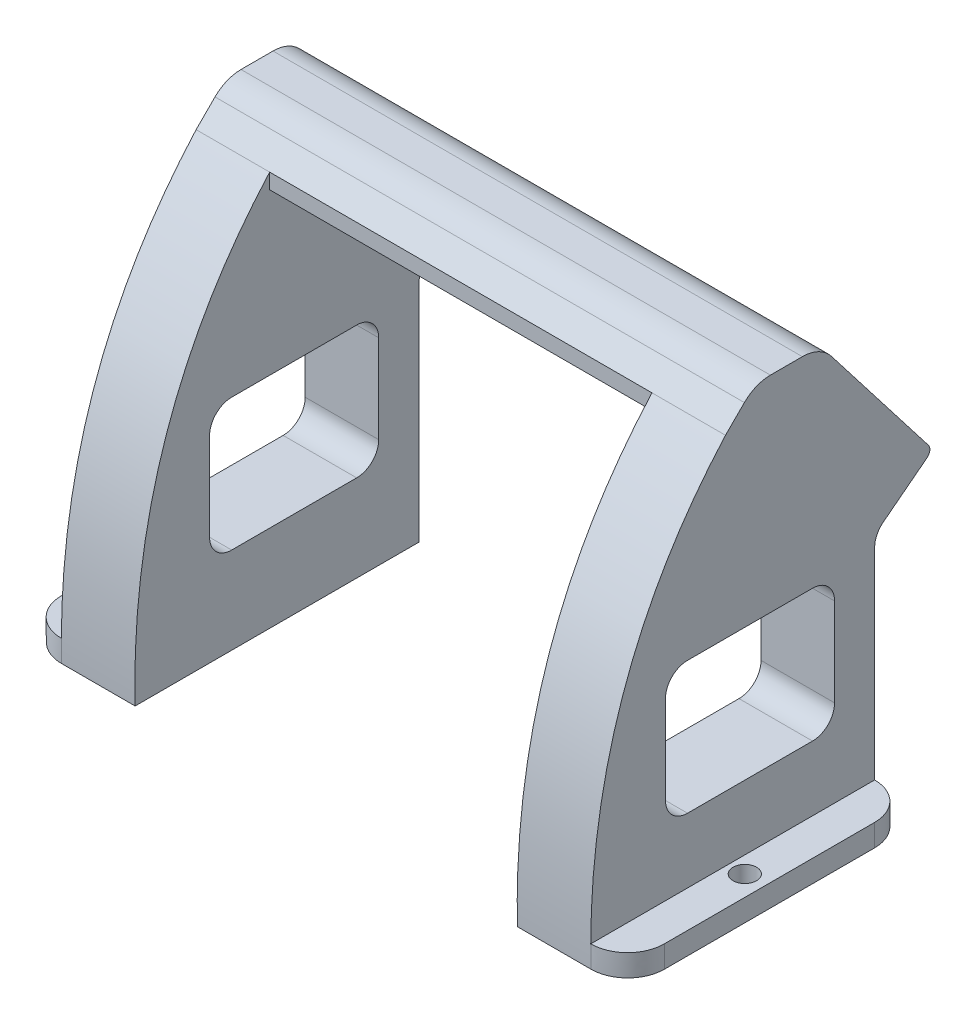
from build123d import *

# Parameters (mm, degrees)
EXTRUDE_1_DEPTH     = 5
SKETCH_2_W          = 5
SKETCH_2_H          = 25
EXTRUDE_2_DEPTH     = 10
EXTRUDE_3_DEPTH     = 43
EXTRUDE_4_DEPTH     = 10
CUT_EXTRUDE_1_DEPTH = 58
EXTRUDE_5_DEPTH     = 7
EXTRUDE_6_DEPTH     = 7
EXTRUDE_7_DEPTH     = 10
EXTRUDE_8_DEPTH     = 72
SKETCH_10_W         = 10
SKETCH_10_H         = 20.288176
EXTRUDE_9_DEPTH     = 5.9
FILLET_START        = -61
FILLET_1_DEPTH      = 74
FILLET_START_2      = -53.20464
FILLET_1_2_DEPTH    = 57.6
FILLET_START_3      = -60
FILLET_1_3_DEPTH    = 10
FILLET_START_4      = 2
FILLET_1_4_DEPTH    = 10
SKETCH_11_W         = 20.288176
SKETCH_11_H         = 3
EXTRUDE_10_DEPTH    = 5
SKETCH_12_R         = 1.6
CUT_EXTRUDE_2_DEPTH = 3
FILLET_3_R          = 1
SKETCH_13_W         = 15
SKETCH_13_H         = 3
EXTRUDE_11_DEPTH    = 2
CUT_EXTRUDE_3_REACH = 83.122
SKETCH_14_W         = 20
SKETCH_14_H         = 10
EXTRUDE_12_DEPTH    = 10
EXTRUDE_START       = 2
EXTRUDE_13_DEPTH    = 15
SKETCH_20_W         = 18
SKETCH_20_H         = 18
CUT_EXTRUDE_5_DEPTH = 98.660914
FILLET_7_R          = 5
CUT_EXTRUDE_6_DEPTH = 98.660914
FILLET_8_R          = 5
FILLET_9_R          = 5
SKETCH_22_W         = 5
SKETCH_22_H         = 18
CUT_EXTRUDE_7_DEPTH = 98.660914
FILLET_10_R         = 3
CUT_EXTRUDE_8_REACH = 98.904
SKETCH_23_R         = 1.6


with BuildPart() as part:
    # 草图1 → 凸台-拉伸1 (new body)
    with BuildSketch(Plane(origin=(0, 0, 0), x_dir=(0, 0, -1), z_dir=(1, 0, 0))):
        Polygon((0, 0), (11.868353, 9.172906), (-3.419823, 28.953494), (-15.288176, 19.780588), align=None)
    extrude(amount=EXTRUDE_1_DEPTH)

    # 草图2 → 凸台-拉伸2 (add)
    with BuildSketch(Plane(origin=(0, 0, 0), x_dir=(1, 0, 0), z_dir=(0, -0.6115270401858328, 0.7912235329674888))):
        with Locations((2.5, 12.5)):
            Rectangle(SKETCH_2_W, SKETCH_2_H)
    extrude(amount=EXTRUDE_2_DEPTH)

    # 草图3 → 凸台-拉伸3 (add)
    with BuildSketch(Plane.ZY):
        Polygon((23.200411, 13.665318), (15.288176, 19.780588), (0, 0), (7.912235, -6.11527), align=None)
    extrude(amount=EXTRUDE_3_DEPTH)

    # 草图4 → 凸台-拉伸4 (add)
    with BuildSketch(Plane.ZY.offset(43)):
        Polygon((15.288176, 19.780588), (3.419823, 28.953494), (-11.868353, 9.172906), (0, 0), (7.912235, -6.11527), (23.200411, 13.665318), align=None)
    extrude(amount=EXTRUDE_4_DEPTH)

    # 草图5 → 切除-拉伸1 (cut)
    with BuildSketch(Plane.ZY.offset(53)):
        Polygon((15.288176, 19.780588), (3.419823, 28.953494), (-11.868353, 9.172906), (0, 0), align=None)
    extrude(amount=-CUT_EXTRUDE_1_DEPTH, mode=Mode.SUBTRACT)

    # 草图6 → 凸台-拉伸5 (add)
    with BuildSketch(Plane.ZY.offset(53)):
        Polygon((15.288176, 19.780588), (0, 0), (7.912235, -6.11527), (23.200411, 13.665318), align=None)
    extrude(amount=EXTRUDE_5_DEPTH)

    # 草图7 → 凸台-拉伸6 (add)
    with BuildSketch(Plane(origin=(5, 0, 0), x_dir=(0, 0, -1), z_dir=(1, 0, 0))):
        Polygon((0, 0), (-15.288176, 19.780588), (-23.200411, 13.665318), (-7.912235, -6.11527), align=None)
    extrude(amount=EXTRUDE_6_DEPTH)

    # 草图8 → 凸台-拉伸7 (add)
    with BuildSketch(Plane(origin=(12, 0, 0), x_dir=(0, 0, -1), z_dir=(1, 0, 0))):
        Polygon((-23.200411, 13.665318), (-28.200411, 13.665318), (-28.200411, -24.848688), (-28.200411, -32.095582), (-7.912235, -32.095582), (-7.912235, -24.848688), (-7.912235, -6.11527), align=None)
    extrude_7 = extrude(amount=-EXTRUDE_7_DEPTH)

    # 镜向1: 凸台-拉伸7 across plane
    add(extrude_7.mirror(Plane.ZY.offset(24)))

    # 草图9 → 凸台-拉伸8 (add)
    with BuildSketch(Plane.ZY.offset(60)):
        Polygon((23.200411, 13.665318), (28.200411, 13.665318), (28.200411, 19.780588), (15.288176, 19.780588), align=None)
    extrude(amount=-EXTRUDE_8_DEPTH)

    # 草图10 → 凸台-拉伸9 (add)
    with BuildSketch(Plane.XZ.offset(32.095582)):
        with Locations((7, 18.056323)):
            Rectangle(SKETCH_10_W, SKETCH_10_H)
        with Locations((-55, 18.056323)):
            Rectangle(SKETCH_10_W, SKETCH_10_H)
    extrude(amount=EXTRUDE_9_DEPTH)

    # 圆角1: read off the stored shape, not the designer's step
    # 圆角1 outline → 圆角1 (cut)
    with BuildSketch(Plane.YZ.offset(FILLET_START)):
        with BuildLine():
            Line((19.780588, 28.200411), (16.780588, 28.200411))
            ThreePointArc((16.780588, 28.200411), (18.901909, 27.321732), (19.780588, 25.200411))
            Line((19.780588, 25.200411), (19.780588, 28.200411))
        make_face()
    extrude(amount=FILLET_1_DEPTH, mode=Mode.SUBTRACT)

    # Fillet 1 2 outline → Fillet 1 2 (add)
    with BuildSketch(Plane.YZ.offset(FILLET_START_2)):
        with BuildLine():
            ThreePointArc((13.665318, 24.673344), (13.358248, 23.351176), (12.499899, 22.299673))
            Line((12.499899, 22.299673), (13.665318, 23.200411))
            Line((13.665318, 23.200411), (13.665318, 24.673344))
        make_face()
    extrude(amount=FILLET_1_2_DEPTH)

    # Fillet 1 3 outline → Fillet 1 3 (add)
    with BuildSketch(Plane.YZ.offset(FILLET_START_3)):
        with BuildLine():
            ThreePointArc((-7.588203, 7.912235), (-6.266035, 7.605165), (-5.214532, 6.746816))
            Line((-5.214532, 6.746816), (-6.11527, 7.912235))
            Line((-6.11527, 7.912235), (-7.588203, 7.912235))
        make_face()
    extrude(amount=FILLET_1_3_DEPTH)

    # Fillet 1 4 outline → Fillet 1 4 (add)
    with BuildSketch(Plane.YZ.offset(FILLET_START_4)):
        with BuildLine():
            ThreePointArc((-7.588203, 7.912235), (-6.266035, 7.605165), (-5.214532, 6.746816))
            Line((-5.214532, 6.746816), (-6.11527, 7.912235))
            Line((-6.11527, 7.912235), (-7.588203, 7.912235))
        make_face()
    extrude(amount=FILLET_1_4_DEPTH)

    # 草图11 → 凸台-拉伸10 (add)
    with BuildSketch(Plane(origin=(12, 0, 0), x_dir=(0, 0, -1), z_dir=(1, 0, 0))):
        with Locations((-18.056323, -36.495582)):
            Rectangle(SKETCH_11_W, SKETCH_11_H)
    extrude_10 = extrude(amount=EXTRUDE_10_DEPTH)

    # 草图12 → 切除-拉伸2 (cut)
    with BuildSketch(Plane(origin=(0, -34.995582, 0), x_dir=(1, 0, 0), z_dir=(0, 1, 0))):
        with Locations((14.243648, -27.816949)):
            Circle(SKETCH_12_R)
    cut_extrude_2 = extrude(amount=-CUT_EXTRUDE_2_DEPTH, mode=Mode.SUBTRACT)

    # 镜向2: 凸台-拉伸10, 切除-拉伸2 across plane
    add(extrude_10.mirror(Plane.ZY.offset(24)))
    add(cut_extrude_2.mirror(Plane.ZY.offset(24)), mode=Mode.SUBTRACT)

    # 圆角3
    fillet_3_edges = [part.edges().sort_by_distance(p)[0] for p in [
        (-24, 0, 0),
    ]]
    fillet(fillet_3_edges, radius=FILLET_3_R)

    # 草图13 → 凸台-拉伸11 (add)
    with BuildSketch(Plane.XY.offset(28.200411)):
        with Locations((-57.5, -36.495582)):
            Rectangle(SKETCH_13_W, SKETCH_13_H)
        with Locations((9.5, -36.495582)):
            Rectangle(SKETCH_13_W, SKETCH_13_H)
    extrude(amount=EXTRUDE_11_DEPTH)

    # 草图14 → 切除-拉伸3 (cut, up to next)
    with BuildSketch(Plane(origin=(0, 0, 0), x_dir=(-1, 0, 0), z_dir=(0, 0.6115270401858329, -0.7912235329674886)), mode=Mode.PRIVATE) as cut_extrude_3_sk1:
        with Locations((24, 13)):
            Rectangle(SKETCH_14_W, SKETCH_14_H)
    cut_extrude_3_tool1 = extrude(cut_extrude_3_sk1.sketch, amount=-CUT_EXTRUDE_3_REACH, mode=Mode.PRIVATE) & part.part
    add(cut_extrude_3_tool1.solids().sort_by_distance((-24, 10.285906, 7.949852))[0], mode=Mode.SUBTRACT)

    # 草图18 → 凸台-拉伸12 (add)
    with BuildSketch(Plane(origin=(12, 0, 0), x_dir=(0, 0, -1), z_dir=(1, 0, 0))):
        with BuildLine():
            Line((-24.411336, 19.674955), (-24.411336, -37.995582))
            Line((-24.411336, -37.995582), (-46.496356, -37.995582))
            add(Edge.make_bspline(
                [(-24.411336, 19.674955), (-47.385024, -2.496577), (-46.496356, -37.995582)],
                knots=[0, 0, 0, 1, 1, 1], degree=2))
        make_face()
    extrude_12 = extrude(amount=-EXTRUDE_12_DEPTH)

    # 凸台-拉伸13: read off the stored shape, not the designer's step
    # 凸台-拉伸13 outline → 凸台-拉伸13 (add)
    with BuildSketch(Plane.YZ.offset(EXTRUDE_START)):
        with BuildLine():
            Line((-34.995582, 30.200411), (-34.995582, 46.528767))
            add(Edge.make_bspline(
                [(-34.995582, 46.528767), (-36.483492, 46.534209), (-37.995582, 46.496356)],
                knots=[0.957405, 0.957405, 0.957405, 1, 1, 1], degree=2))
            Line((-37.995582, 46.496356), (-37.995582, 30.200411))
            Line((-37.995582, 30.200411), (-34.995582, 30.200411))
        make_face()
    extrude_13 = extrude(amount=EXTRUDE_13_DEPTH)

    # 镜向3: 凸台-拉伸12, 凸台-拉伸13 across plane
    add(extrude_12.mirror(Plane.ZY.offset(24)))
    add(extrude_13.mirror(Plane.ZY.offset(24)))

    # 草图20 → 切除-拉伸5 (cut, through all)
    with BuildSketch(Plane(origin=(12, 0, 0), x_dir=(0, 0, -1), z_dir=(1, 0, 0))):
        with Locations((-22.365109, -17.186728)):
            Rectangle(SKETCH_20_W, SKETCH_20_H)
    extrude(amount=-CUT_EXTRUDE_5_DEPTH, mode=Mode.SUBTRACT)

    # 圆角7
    fillet_7_edges = [part.edges().sort_by_distance(p)[0] for p in [
        (17, -36.489537, 46.523386),
        (-65, -36.495582, 7.912235),
        (17, -36.495582, 7.912235),
        (-65, -36.489537, 46.523386),
    ]]
    fillet(fillet_7_edges, radius=FILLET_7_R - 0.0001)  # a hair under: the kernel refuses the full size

    # 草图21 → 切除-拉伸6 (cut, through all)
    with BuildSketch(Plane(origin=(12, 0, 0), x_dir=(0, 0, -1), z_dir=(1, 0, 0))):
        with BuildLine():
            Line((-28.200411, 15.747176), (-24.166999, 19.780588))
            Line((-24.166999, 19.780588), (-25.200411, 19.780588))
            ThreePointArc((-25.200411, 19.780588), (-27.321732, 18.901909), (-28.200411, 16.780588))
            Line((-28.200411, 16.780588), (-28.200411, 15.747176))
        make_face()
    extrude(amount=-CUT_EXTRUDE_6_DEPTH, mode=Mode.SUBTRACT)

    # 圆角8
    fillet_8_edges = [part.edges().sort_by_distance(p)[0] for p in [
        (-24, 19.780588, 24.166999),
    ]]
    fillet(fillet_8_edges, radius=FILLET_8_R)

    # 圆角9
    fillet_9_edges = [part.edges().sort_by_distance(p)[0] for p in [
        (-24, 19.780588, 15.288176),
    ]]
    fillet(fillet_9_edges, radius=FILLET_9_R)

    # 草图22 → 切除-拉伸7 (cut, through all)
    with BuildSketch(Plane.ZY.offset(60)):
        with Locations((33.865109, -17.186728)):
            Rectangle(SKETCH_22_W, SKETCH_22_H)
    extrude(amount=-CUT_EXTRUDE_7_DEPTH, mode=Mode.SUBTRACT)

    # 圆角10
    fillet_10_edges = [part.edges().sort_by_distance(p)[0] for p in [
        (7, -8.186728, 13.365109),
        (-55, -8.186728, 13.365109),
        (7, -26.186728, 13.365109),
        (-55, -26.186728, 13.365109),
        (7, -8.186728, 36.365109),
        (-55, -8.186728, 36.365109),
        (7, -26.186728, 36.365109),
        (-55, -26.186728, 36.365109),
    ]]
    fillet(fillet_10_edges, radius=FILLET_10_R)

    # 草图23 → 切除-拉伸8 (cut, up to next)
    with BuildSketch(Plane(origin=(0, -34.995582, 0), x_dir=(1, 0, 0), z_dir=(0, 1, 0)), mode=Mode.PRIVATE) as cut_extrude_8_sk1:
        with Locations(Location((14.243648, -27.816949, 0), (0, 0, 270))):
            Circle(SKETCH_23_R)
    cut_extrude_8_tool1 = extrude(cut_extrude_8_sk1.sketch, amount=-CUT_EXTRUDE_8_REACH, mode=Mode.PRIVATE) & part.part
    # 草图23 → 切除-拉伸8 (cut, up to next)
    with BuildSketch(Plane(origin=(0, -34.995582, 0), x_dir=(1, 0, 0), z_dir=(0, 1, 0)), mode=Mode.PRIVATE) as cut_extrude_8_sk2:
        with Locations(Location((-62.243648, -27.816949, 0), (0, 0, 270))):
            Circle(SKETCH_23_R)
    cut_extrude_8_tool2 = extrude(cut_extrude_8_sk2.sketch, amount=-CUT_EXTRUDE_8_REACH, mode=Mode.PRIVATE) & part.part
    add(cut_extrude_8_tool1.solids().sort_by_distance((14.243648, -34.995582, 27.816949))[0], mode=Mode.SUBTRACT)
    add(cut_extrude_8_tool2.solids().sort_by_distance((-62.243648, -34.995582, 27.816949))[0], mode=Mode.SUBTRACT)


solid = part.part
